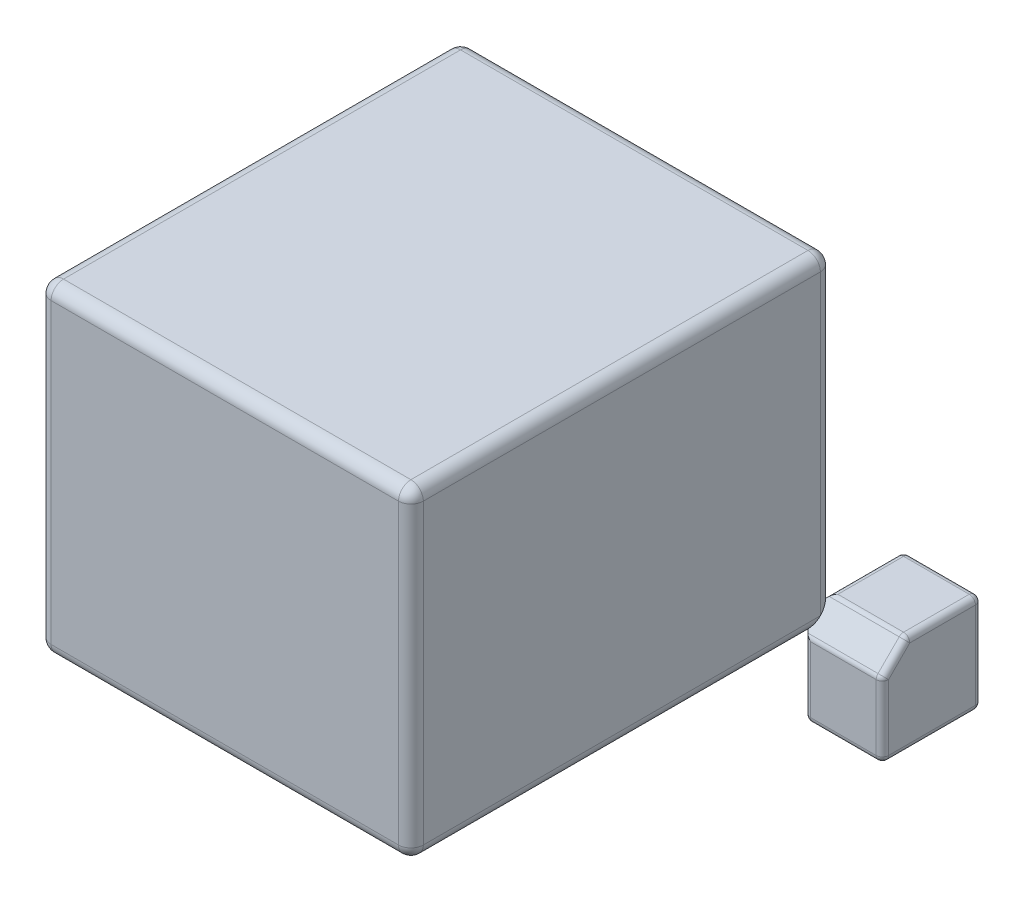
from build123d import *

# Parameters (mm, degrees)
SKETCH1_W                = 30
SKETCH1_H                = 26
BOSS_EXTRUDE1_DEPTH      = 34
SHELL1_T                 = 1
BOSS_EXTRUDE3_DEPTH      = 6
BOSS_EXTRUDE3_DEPTH_BACK = 2
SKETCH2_W                = 8
SKETCH2_H                = 8
CHAMFER2_SIZE            = 2
FILLET1_R                = 1
FILLET2_R                = 0.5


with BuildPart() as part:
    # Sketch1 → Boss-Extrude1 (new body)
    with BuildSketch(Plane.XY):
        with Locations((15, 13)):
            Rectangle(SKETCH1_W, SKETCH1_H)
    extrude(amount=BOSS_EXTRUDE1_DEPTH)

    # Shell1 (no face opened: a closed hollow body)
    add(offset(amount=-SHELL1_T, mode=Mode.PRIVATE), mode=Mode.SUBTRACT)

    # Sketch2 → Boss-Extrude3 (add, two sides: drawn at the far end of the back side and taken through both)
    with BuildSketch(Plane(origin=(0, 0, 0), x_dir=(-1, 0, 0), z_dir=(0, 0, -1)).offset(-BOSS_EXTRUDE3_DEPTH_BACK)):
        with Locations((-32, -2)):
            Rectangle(SKETCH2_W, SKETCH2_H)
    extrude(amount=BOSS_EXTRUDE3_DEPTH + BOSS_EXTRUDE3_DEPTH_BACK)

    # Chamfer2
    chamfer2_edges = [part.edges().sort_by_distance(p)[0] for p in [
        (28, -3, 2),
        (28, 2, -3),
        (33, 2, 2),
    ]]
    chamfer(chamfer2_edges, length=CHAMFER2_SIZE)

    # Fillet1
    # the kernel refuses this fillet: 1 mm, written as the material it takes off along each edge
    with BuildSketch(Plane(origin=(1, 25, 1), x_dir=(0, 1, 0), z_dir=(0, 0, -1))) as fillet1_piece_1_section:
        Polygon((0, 0), (FILLET1_R, 0), (FILLET1_R, -FILLET1_R), (0, -FILLET1_R), align=None)
    fillet1_piece_1 = extrude(amount=FILLET1_R, mode=Mode.PRIVATE)
    fillet1_piece_1 = fillet1_piece_1 - Plane(origin=(1, 25, 1), x_dir=(0.7071067811865475, -0.7071067811865475, 0), z_dir=(0, 0, -1)) * Sphere(FILLET1_R, mode=Mode.PRIVATE)
    add(fillet1_piece_1, mode=Mode.SUBTRACT)
    with BuildSketch(Plane(origin=(1, 1, 1), x_dir=(0, 0, -1), z_dir=(0, -1, 0))) as fillet1_piece_2_section:
        Polygon((0, 0), (FILLET1_R, 0), (FILLET1_R, -FILLET1_R), (0, -FILLET1_R), align=None)
    fillet1_piece_2 = extrude(amount=FILLET1_R, mode=Mode.PRIVATE)
    fillet1_piece_2 = fillet1_piece_2 - Plane(origin=(1, 1, 1), x_dir=(0.7071067811865475, 0, 0.7071067811865475), z_dir=(0, -1, 0)) * Sphere(FILLET1_R, mode=Mode.PRIVATE)
    add(fillet1_piece_2, mode=Mode.SUBTRACT)
    with BuildSketch(Plane(origin=(29, 25, 1), x_dir=(0, 0, -1), z_dir=(0, 1, 0))) as fillet1_piece_3_section:
        Polygon((0, 0), (FILLET1_R, 0), (FILLET1_R, -FILLET1_R), (0, -FILLET1_R), align=None)
    fillet1_piece_3 = extrude(amount=FILLET1_R, mode=Mode.PRIVATE)
    fillet1_piece_3 = fillet1_piece_3 - Plane(origin=(29, 25, 1), x_dir=(-0.7071067811865475, 0, 0.7071067811865475), z_dir=(0, 1, 0)) * Sphere(FILLET1_R, mode=Mode.PRIVATE)
    add(fillet1_piece_3, mode=Mode.SUBTRACT)
    with BuildSketch(Plane(origin=(1, 1, 33), x_dir=(-1, 0, 0), z_dir=(0, -1, 0))) as fillet1_piece_4_section:
        Polygon((0, 0), (FILLET1_R, 0), (FILLET1_R, -FILLET1_R), (0, -FILLET1_R), align=None)
    fillet1_piece_4 = extrude(amount=FILLET1_R, mode=Mode.PRIVATE)
    fillet1_piece_4 = fillet1_piece_4 - Plane(origin=(1, 1, 33), x_dir=(0.7071067811865475, 0, -0.7071067811865475), z_dir=(0, -1, 0)) * Sphere(FILLET1_R, mode=Mode.PRIVATE)
    add(fillet1_piece_4, mode=Mode.SUBTRACT)
    with BuildSketch(Plane(origin=(29, 1, 33), x_dir=(1, 0, 0), z_dir=(0, -1, 0))) as fillet1_piece_5_section:
        Polygon((0, 0), (FILLET1_R, 0), (FILLET1_R, FILLET1_R), (0, FILLET1_R), align=None)
    fillet1_piece_5 = extrude(amount=FILLET1_R, mode=Mode.PRIVATE)
    fillet1_piece_5 = fillet1_piece_5 - Plane(origin=(29, 1, 33), x_dir=(-0.7071067811865475, 0, -0.7071067811865475), z_dir=(0, -1, 0)) * Sphere(FILLET1_R, mode=Mode.PRIVATE)
    add(fillet1_piece_5, mode=Mode.SUBTRACT)
    with BuildSketch(Plane(origin=(29, 25, 33), x_dir=(1, 0, 0), z_dir=(0, 1, 0))) as fillet1_piece_6_section:
        Polygon((0, 0), (FILLET1_R, 0), (FILLET1_R, -FILLET1_R), (0, -FILLET1_R), align=None)
    fillet1_piece_6 = extrude(amount=FILLET1_R, mode=Mode.PRIVATE)
    fillet1_piece_6 = fillet1_piece_6 - Plane(origin=(29, 25, 33), x_dir=(-0.7071067811865475, 0, -0.7071067811865475), z_dir=(0, 1, 0)) * Sphere(FILLET1_R, mode=Mode.PRIVATE)
    add(fillet1_piece_6, mode=Mode.SUBTRACT)
    with BuildSketch(Plane(origin=(1, 25, 33), x_dir=(-1, 0, 0), z_dir=(0, 1, 0))) as fillet1_piece_7_section:
        Polygon((0, 0), (FILLET1_R, 0), (FILLET1_R, FILLET1_R), (0, FILLET1_R), align=None)
    fillet1_piece_7 = extrude(amount=FILLET1_R, mode=Mode.PRIVATE)
    fillet1_piece_7 = fillet1_piece_7 - Plane(origin=(1, 25, 33), x_dir=(0.7071067811865475, 0, -0.7071067811865475), z_dir=(0, 1, 0)) * Sphere(FILLET1_R, mode=Mode.PRIVATE)
    add(fillet1_piece_7, mode=Mode.SUBTRACT)
    with BuildSketch(Plane(origin=(0, 25, 0), x_dir=(1, 0, 0), z_dir=(0, -1, 0)), Plane(origin=(30, 1, 34), x_dir=(0, 0, -1), z_dir=(0, 1, 0)), Plane(origin=(0, 25, 34), x_dir=(0, 0, -1), z_dir=(0, -1, 0))) as fillet1_piece_8:
        with BuildLine():
            CenterArc((FILLET1_R, FILLET1_R), FILLET1_R, 180, 90)
            Line((0, FILLET1_R), (0, 0))
            Line((0, 0), (FILLET1_R, 0))
        make_face()
    extrude(amount=24, mode=Mode.SUBTRACT)
    with BuildSketch(Plane(origin=(1, 0, 0), x_dir=(0, 0, 1), z_dir=(1, 0, 0))) as fillet1_piece_9_section:
        with BuildLine():
            CenterArc((FILLET1_R, -FILLET1_R), FILLET1_R, 90, 90)
            Line((0, -FILLET1_R), (0, 0))
            Line((0, 0), (FILLET1_R, 0))
        make_face()
    fillet1_piece_9 = extrude(amount=29.5, mode=Mode.PRIVATE)
    fillet1_piece_9 = split(fillet1_piece_9, bisect_by=Plane(origin=(21.381816869, 0.226411675, -6.618183131), z_dir=(-0.7071067811865476, 0, 0.7071067811865476)), keep=Keep.TOP, mode=Mode.PRIVATE)
    fillet1_piece_9 = split(fillet1_piece_9, bisect_by=Plane(origin=(21.381816869, -6.618183131, 0.226411675), z_dir=(-0.7071067811865476, 0.7071067811865476, 0)), keep=Keep.TOP, mode=Mode.PRIVATE)
    add(fillet1_piece_9, mode=Mode.SUBTRACT)
    with BuildSketch(Plane(origin=(1, 0, 0), x_dir=(0, 0, 1), z_dir=(1, 0, 0))) as fillet1_piece_10_section:
        with BuildLine():
            CenterArc((FILLET1_R, -FILLET1_R), FILLET1_R, 90, 90)
            Line((0, -FILLET1_R), (0, 0))
            Line((0, 0), (FILLET1_R, 0))
        make_face()
    fillet1_piece_10 = extrude(amount=29.5, mode=Mode.PRIVATE)
    fillet1_piece_10 = split(fillet1_piece_10, bisect_by=Plane(origin=(28.16446835, 0.528927527, 0.16446835), z_dir=(0.7071067811865476, 0, -0.7071067811865476)), keep=Keep.TOP, mode=Mode.PRIVATE)
    fillet1_piece_10 = split(fillet1_piece_10, bisect_by=Plane(origin=(28.407441135, 0.407441135, 0.042981958), z_dir=(-0.7071067811865476, 0.7071067811865476, 0)), keep=Keep.TOP, mode=Mode.PRIVATE)
    add(fillet1_piece_10, mode=Mode.SUBTRACT)
    with BuildSketch(Plane(origin=(1, 0, 0), x_dir=(0, 0, 1), z_dir=(1, 0, 0))) as fillet1_piece_11_section:
        with BuildLine():
            CenterArc((FILLET1_R, -FILLET1_R), FILLET1_R, 90, 90)
            Line((0, -FILLET1_R), (0, 0))
            Line((0, 0), (FILLET1_R, 0))
        make_face()
    fillet1_piece_11 = extrude(amount=29.5, mode=Mode.PRIVATE)
    fillet1_piece_11 = split(fillet1_piece_11, bisect_by=Plane(origin=(28.407441135, 0.042981958, 0.407441135), z_dir=(-0.7071067811865476, 0, 0.7071067811865476)), keep=Keep.TOP, mode=Mode.PRIVATE)
    fillet1_piece_11 = split(fillet1_piece_11, bisect_by=Plane(origin=(28.16446835, 0.16446835, 0.528927527), z_dir=(0.7071067811865476, -0.7071067811865476, 0)), keep=Keep.TOP, mode=Mode.PRIVATE)
    add(fillet1_piece_11, mode=Mode.SUBTRACT)
    with BuildSketch(Plane(origin=(30, -0.5, 0), x_dir=(-1, 0, 0), z_dir=(0, 1, 0))) as fillet1_piece_12_section:
        with BuildLine():
            CenterArc((FILLET1_R, FILLET1_R), FILLET1_R, 180, 90)
            Line((0, FILLET1_R), (0, 0))
            Line((0, 0), (FILLET1_R, 0))
        make_face()
    fillet1_piece_12 = extrude(amount=25.5, mode=Mode.PRIVATE)
    fillet1_piece_12 = split(fillet1_piece_12, bisect_by=Plane(origin=(29.83553165, 1.83553165, 0.528927527), z_dir=(0.7071067811865476, -0.7071067811865476, 0)), keep=Keep.TOP, mode=Mode.PRIVATE)
    fillet1_piece_12 = split(fillet1_piece_12, bisect_by=Plane(origin=(29.957018042, 1.592558865, 0.407441135), z_dir=(0, 0.7071067811865476, 0.7071067811865476)), keep=Keep.TOP, mode=Mode.PRIVATE)
    add(fillet1_piece_12, mode=Mode.SUBTRACT)
    with BuildSketch(Plane(origin=(30, -0.5, 0), x_dir=(-1, 0, 0), z_dir=(0, 1, 0))) as fillet1_piece_13_section:
        with BuildLine():
            CenterArc((FILLET1_R, FILLET1_R), FILLET1_R, 180, 90)
            Line((0, FILLET1_R), (0, 0))
            Line((0, 0), (FILLET1_R, 0))
        make_face()
    fillet1_piece_13 = extrude(amount=25.5, mode=Mode.PRIVATE)
    fillet1_piece_13 = split(fillet1_piece_13, bisect_by=Plane(origin=(29.592558865, 1.592558865, 0.042981958), z_dir=(-0.7071067811865476, 0.7071067811865476, 0)), keep=Keep.TOP, mode=Mode.PRIVATE)
    fillet1_piece_13 = split(fillet1_piece_13, bisect_by=Plane(origin=(29.471072473, 1.83553165, 0.16446835), z_dir=(0, -0.7071067811865476, -0.7071067811865476)), keep=Keep.TOP, mode=Mode.PRIVATE)
    add(fillet1_piece_13, mode=Mode.SUBTRACT)
    with BuildSketch(Plane(origin=(30, -0.5, 0), x_dir=(-1, 0, 0), z_dir=(0, 1, 0))) as fillet1_piece_14_section:
        with BuildLine():
            CenterArc((FILLET1_R, FILLET1_R), FILLET1_R, 180, 90)
            Line((0, FILLET1_R), (0, 0))
            Line((0, 0), (FILLET1_R, 0))
        make_face()
    fillet1_piece_14 = extrude(amount=25.5, mode=Mode.PRIVATE)
    fillet1_piece_14 = split(fillet1_piece_14, bisect_by=Plane(origin=(35.618173362, 7.618173362, 0.226414546), z_dir=(-0.7071067811865476, 0.7071067811865476, 0)), keep=Keep.TOP, mode=Mode.PRIVATE)
    fillet1_piece_14 = split(fillet1_piece_14, bisect_by=Plane(origin=(29.773585454, 7.618173362, -5.618173362), z_dir=(0, 0.7071067811865476, 0.7071067811865476)), keep=Keep.TOP, mode=Mode.PRIVATE)
    add(fillet1_piece_14, mode=Mode.SUBTRACT)
    with BuildSketch(Plane(origin=(29, 26, 0), x_dir=(0, -1, 0), z_dir=(-1, 0, 0)), Plane(origin=(1, 0, 34), x_dir=(0, 0, -1), z_dir=(1, 0, 0))) as fillet1_piece_15:
        with BuildLine():
            CenterArc((FILLET1_R, FILLET1_R), FILLET1_R, 180, 90)
            Line((0, FILLET1_R), (0, 0))
            Line((0, 0), (FILLET1_R, 0))
        make_face()
    extrude(amount=28, mode=Mode.SUBTRACT)
    with BuildSketch(Plane(origin=(29, 26, 34), x_dir=(0, -1, 0), z_dir=(-1, 0, 0))) as fillet1_piece_16:
        with BuildLine():
            CenterArc((FILLET1_R, -FILLET1_R), FILLET1_R, 90, 90)
            Line((0, -FILLET1_R), (0, 0))
            Line((0, 0), (FILLET1_R, 0))
        make_face()
    extrude(amount=28, mode=Mode.SUBTRACT)
    with BuildSketch(Plane(origin=(0, 26, 1), x_dir=(0, -1, 0), z_dir=(0, 0, 1)), Plane(origin=(0, 0, 1), x_dir=(1, 0, 0), z_dir=(0, 0, 1))) as fillet1_piece_17:
        with BuildLine():
            CenterArc((FILLET1_R, FILLET1_R), FILLET1_R, 180, 90)
            Line((0, FILLET1_R), (0, 0))
            Line((0, 0), (FILLET1_R, 0))
        make_face()
    extrude(amount=32, mode=Mode.SUBTRACT)
    with BuildSketch(Plane(origin=(30, 26, 1), x_dir=(0, -1, 0), z_dir=(0, 0, 1))) as fillet1_piece_18:
        with BuildLine():
            CenterArc((FILLET1_R, -FILLET1_R), FILLET1_R, 90, 90)
            Line((0, -FILLET1_R), (0, 0))
            Line((0, 0), (FILLET1_R, 0))
        make_face()
    extrude(amount=32, mode=Mode.SUBTRACT)
    with BuildSketch(Plane(origin=(30, 0, -0.5), x_dir=(-1, 0, 0), z_dir=(0, 0, 1))) as fillet1_piece_19_section:
        with BuildLine():
            CenterArc((FILLET1_R, -FILLET1_R), FILLET1_R, 90, 90)
            Line((0, -FILLET1_R), (0, 0))
            Line((0, 0), (FILLET1_R, 0))
        make_face()
    fillet1_piece_19 = extrude(amount=33.5, mode=Mode.PRIVATE)
    fillet1_piece_19 = split(fillet1_piece_19, bisect_by=Plane(origin=(29.83553165, 0.528927527, 1.83553165), z_dir=(0.7071067811865476, 0, -0.7071067811865476)), keep=Keep.TOP, mode=Mode.PRIVATE)
    fillet1_piece_19 = split(fillet1_piece_19, bisect_by=Plane(origin=(29.957018042, 0.407441135, 1.592558865), z_dir=(0, 0.7071067811865476, 0.7071067811865476)), keep=Keep.TOP, mode=Mode.PRIVATE)
    add(fillet1_piece_19, mode=Mode.SUBTRACT)
    with BuildSketch(Plane(origin=(30, 0, -0.5), x_dir=(-1, 0, 0), z_dir=(0, 0, 1))) as fillet1_piece_20_section:
        with BuildLine():
            CenterArc((FILLET1_R, -FILLET1_R), FILLET1_R, 90, 90)
            Line((0, -FILLET1_R), (0, 0))
            Line((0, 0), (FILLET1_R, 0))
        make_face()
    fillet1_piece_20 = extrude(amount=33.5, mode=Mode.PRIVATE)
    fillet1_piece_20 = split(fillet1_piece_20, bisect_by=Plane(origin=(29.592558865, 0.042981958, 1.592558865), z_dir=(-0.7071067811865476, 0, 0.7071067811865476)), keep=Keep.TOP, mode=Mode.PRIVATE)
    fillet1_piece_20 = split(fillet1_piece_20, bisect_by=Plane(origin=(29.471072473, 0.16446835, 1.83553165), z_dir=(0, -0.7071067811865476, -0.7071067811865476)), keep=Keep.TOP, mode=Mode.PRIVATE)
    add(fillet1_piece_20, mode=Mode.SUBTRACT)
    with BuildSketch(Plane(origin=(30, 0, -0.5), x_dir=(-1, 0, 0), z_dir=(0, 0, 1))) as fillet1_piece_21_section:
        with BuildLine():
            CenterArc((FILLET1_R, -FILLET1_R), FILLET1_R, 90, 90)
            Line((0, -FILLET1_R), (0, 0))
            Line((0, 0), (FILLET1_R, 0))
        make_face()
    fillet1_piece_21 = extrude(amount=33.5, mode=Mode.PRIVATE)
    fillet1_piece_21 = split(fillet1_piece_21, bisect_by=Plane(origin=(37.618190384, 0.226409543, 9.618190384), z_dir=(-0.7071067811865476, 0, 0.7071067811865476)), keep=Keep.TOP, mode=Mode.PRIVATE)
    fillet1_piece_21 = split(fillet1_piece_21, bisect_by=Plane(origin=(29.773590457, -7.618190384, 9.618190384), z_dir=(0, 0.7071067811865476, 0.7071067811865476)), keep=Keep.TOP, mode=Mode.PRIVATE)
    add(fillet1_piece_21, mode=Mode.SUBTRACT)

    # Fillet2
    fillet2_edges = [part.edges().sort_by_distance(p)[0] for p in [
        (32, -6, -6),
        (36, -6, -2),
        (36, -2, -6),
        (36, 2, -3),
        (33, 2, -6),
        (30, 2, -3),
        (33, 2, 0),
        (36, -3, 2),
        (36, 1, 1),
        (33, -6, 2),
        (30, -3, 2),
        (33, 0, 2),
        (28, -3, -6),
        (28, -6, -3),
        (28, -3, 0),
        (28, 0, -3),
        (29, 1, -6),
        (29, -6, 1),
    ]]
    fillet(fillet2_edges, radius=FILLET2_R)


solid = part.part
